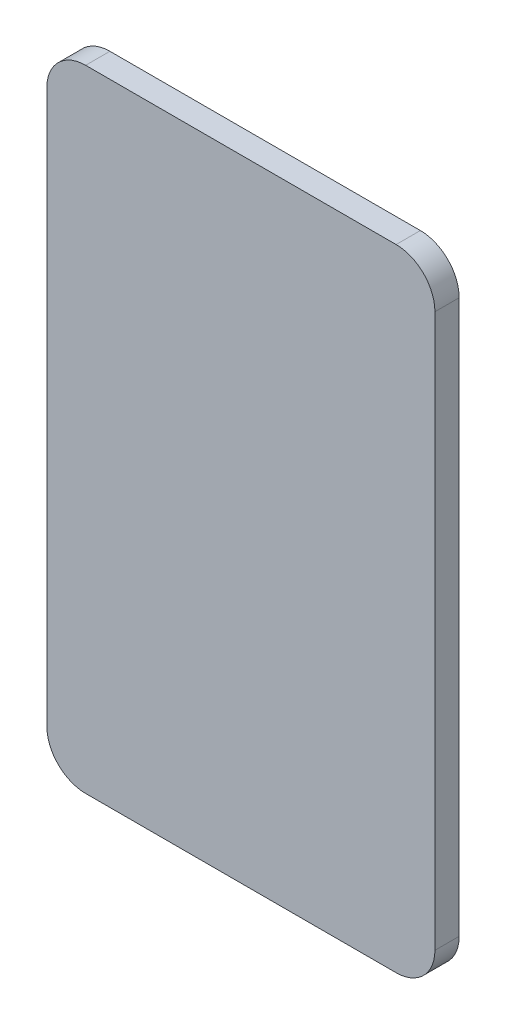
from build123d import *

# Parameters (mm, degrees)
BOSS_EXTRUDE1_DEPTH = 5


with BuildPart() as part:
    # Sketch1 → Boss-Extrude1 (new body)
    with BuildSketch(Plane.XY):
        with BuildLine():
            Line((-32, 65), (32, 65))
            ThreePointArc((32, 65), (37.656854249, 62.656854249), (40, 57))
            Line((40, 57), (40, -57))
            ThreePointArc((40, -57), (37.656854249, -62.656854249), (32, -65))
            Line((32, -65), (-32, -65))
            ThreePointArc((-32, -65), (-37.656854249, -62.656854249), (-40, -57))
            Line((-40, -57), (-40, 57))
            ThreePointArc((-40, 57), (-37.656854249, 62.656854249), (-32, 65))
        make_face()
    extrude(amount=BOSS_EXTRUDE1_DEPTH)


solid = part.part
